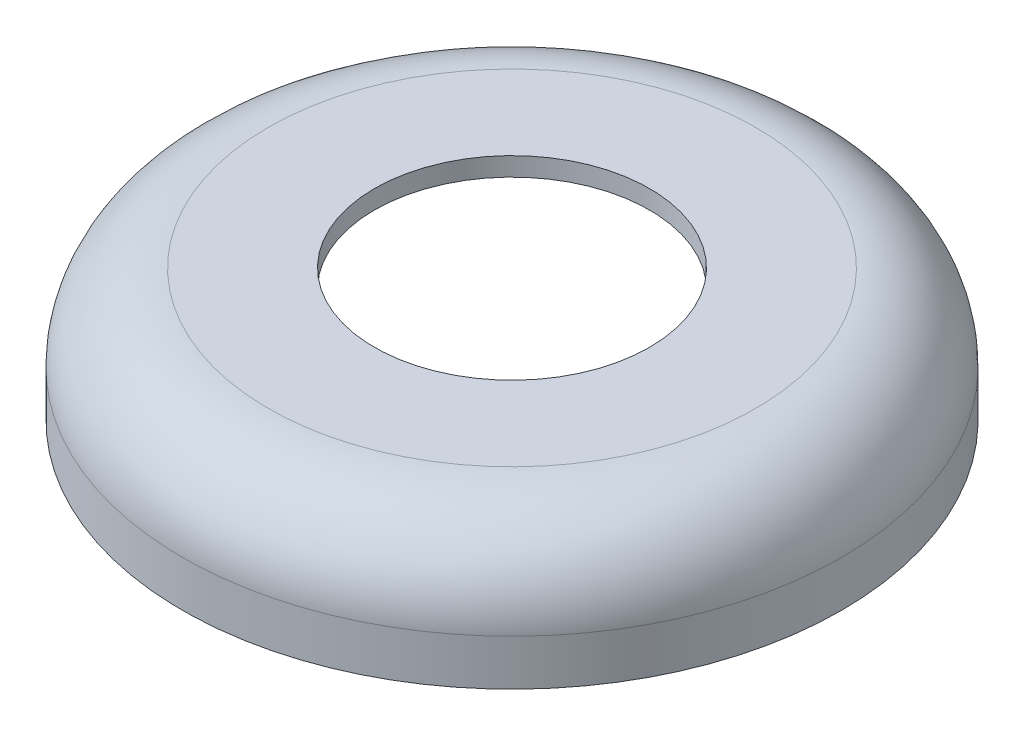
from build123d import *

# Parameters (mm, degrees)
SHELL1_T           = -0.65
CUT_EXTRUDE1_REACH = 18.901
SKETCH2_R          = 4.8


with BuildPart() as part:
    # Sketch1 → Revolve1 (revolve)
    with BuildSketch(Plane.XY):
        with BuildLine():
            Line((0, 0), (8.5, 0))
            ThreePointArc((8.5, 0), (10.621320344, -0.878679656), (11.5, -3))
            Line((11.5, -3), (11.5, -4.6))
            Line((11.5, -4.6), (0, -4.6))
            Line((0, -4.6), (0, 0))
        make_face()
    revolve(axis=Axis((0, 0, 0), (0, -1, 0)))

    # Shell1
    shell1_openings = [part.faces().sort_by_distance(p)[0] for p in [
        (0, -4.6, 0),
    ]]
    offset(amount=SHELL1_T, openings=shell1_openings, kind=Kind.INTERSECTION)

    # Sketch2 → Cut-Extrude1 (cut, up to next)
    with BuildSketch(Plane(origin=(0, 0, 0), x_dir=(1, 0, 0), z_dir=(0, 1, 0)), mode=Mode.PRIVATE) as cut_extrude1_sk1:
        Circle(SKETCH2_R)
    cut_extrude1_tool1 = extrude(cut_extrude1_sk1.sketch, amount=-CUT_EXTRUDE1_REACH, mode=Mode.PRIVATE) & part.part
    add(cut_extrude1_tool1.solids().sort_by_distance((0, 0, 0))[0], mode=Mode.SUBTRACT)


solid = part.part
